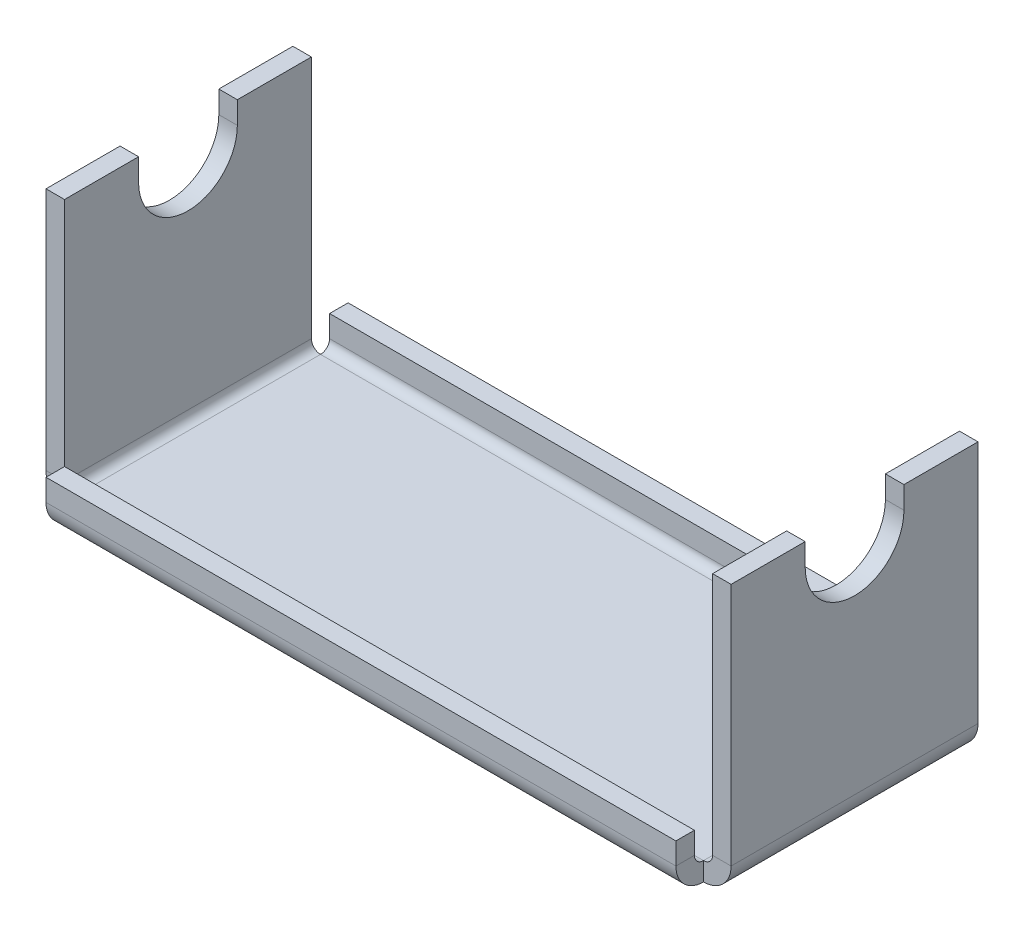
from build123d import *

# Parameters (mm, degrees)
CROQUIS3_W                         = 55.5
CROQUIS3_H                         = 20
BRIDA_BASE1_DEPTH                  = 1.5
BRIDA_DE_ARISTA1_STRIP_W           = 7.4732
BRIDA_DE_ARISTA1_STRIP_H           = 1.5
BRIDA_DE_ARISTA1_STRIP_CUT_DEPTH   = 20
BRIDA_DE_ARISTA1_STRIP_2_W         = 7.4732
BRIDA_DE_ARISTA1_STRIP_2_H         = 1.5
BRIDA_DE_ARISTA1_STRIP_CUT_2_DEPTH = 20
BRIDA_DE_ARISTA1_DEPTH             = 20
BRIDA_DE_ARISTA1_BEND_DEPTH        = 20
BRIDA_DE_ARISTA2_DEPTH             = 51.0268
BRIDA_DE_ARISTA2_BEND_DEPTH        = 51.0268
CORTAR_EXTRUIR1_REACH              = 62.417


# Sheet-metal steps are written as plain solids
with BuildPart() as part:
    # Croquis3 → Brida base1 (new body)
    with BuildSketch(Plane(origin=(0, 0, 0), x_dir=(1, 0, 0), z_dir=(0, 1, 0))):
        Rectangle(CROQUIS3_W, CROQUIS3_H)
    extrude(amount=-BRIDA_BASE1_DEPTH)

    # Brida de arista1 strip (across the edge) → Brida de arista1 strip cut (cut)
    with BuildSketch(Plane(origin=(-27.75, 0, -10), x_dir=(1, 0, 0), z_dir=(0, 0, 1))):
        with Locations((-1.5, -0.75)):
            Rectangle(BRIDA_DE_ARISTA1_STRIP_W, BRIDA_DE_ARISTA1_STRIP_H)
    extrude(amount=BRIDA_DE_ARISTA1_STRIP_CUT_DEPTH, mode=Mode.SUBTRACT)

    # Brida de arista1 strip 2 (across the edge) → Brida de arista1 strip cut 2 (cut)
    with BuildSketch(Plane(origin=(27.75, 0, 10), x_dir=(-1, 0, 0), z_dir=(0, 0, -1))):
        with Locations((-1.5, -0.75)):
            Rectangle(BRIDA_DE_ARISTA1_STRIP_2_W, BRIDA_DE_ARISTA1_STRIP_2_H)
    extrude(amount=BRIDA_DE_ARISTA1_STRIP_CUT_2_DEPTH, mode=Mode.SUBTRACT)

    # Brida de arista1 section (across the edge) → Brida de arista1 (add)
    with BuildSketch(Plane(origin=(-27.75, 0, -10), x_dir=(1, 0, 0), z_dir=(0, 0, 1))):
        with BuildLine():
            Line((0, 0.7366), (0, 20.5))
            Line((0, 20.5), (1.5, 20.5))
            Line((1.5, 20.5), (1.5, 0.7366))
            ThreePointArc((1.5, 0.7366), (1.715745145, 0.215745145), (2.2366, 0))
            Line((2.2366, 0), (2.2366, -1.5))
            ThreePointArc((2.2366, -1.5), (0.655084973, -0.844915027), (0, 0.7366))
        make_face()
    extrude(amount=BRIDA_DE_ARISTA1_DEPTH)

    # Brida de arista1 section 2 (across the edge) → Brida de arista1 bend (add)
    with BuildSketch(Plane(origin=(27.75, 0, 10), x_dir=(-1, 0, 0), z_dir=(0, 0, -1))):
        with BuildLine():
            Line((0, 0.7366), (0, 20.5))
            Line((0, 20.5), (1.5, 20.5))
            Line((1.5, 20.5), (1.5, 0.7366))
            ThreePointArc((1.5, 0.7366), (1.715745145, 0.215745145), (2.2366, 0))
            Line((2.2366, 0), (2.2366, -1.5))
            ThreePointArc((2.2366, -1.5), (0.655084973, -0.844915027), (0, 0.7366))
        make_face()
    extrude(amount=BRIDA_DE_ARISTA1_BEND_DEPTH)

    # Brida de arista2 section (across the edge) → Brida de arista2 (add)
    with BuildSketch(Plane(origin=(-25.5134, 0, 10.7366), x_dir=(0, 0, -1), z_dir=(1, 0, 0))):
        with BuildLine():
            Line((-1.5, 0.7366), (-1.5, 2.5))
            Line((-1.5, 2.5), (0, 2.5))
            Line((0, 2.5), (0, 0.7366))
            ThreePointArc((0, 0.7366), (0.215745145, 0.215745145), (0.7366, 0))
            Line((0.7366, 0), (0.7366, -1.5))
            ThreePointArc((0.7366, -1.5), (-0.844915027, -0.844915027), (-1.5, 0.7366))
        make_face()
    extrude(amount=BRIDA_DE_ARISTA2_DEPTH)

    # Brida de arista2 section 2 (across the edge) → Brida de arista2 bend (add)
    with BuildSketch(Plane(origin=(25.5134, 0, -10.7366), x_dir=(0, 0, 1), z_dir=(-1, 0, 0))):
        with BuildLine():
            Line((-1.5, 0.7366), (-1.5, 2.5))
            Line((-1.5, 2.5), (0, 2.5))
            Line((0, 2.5), (0, 0.7366))
            ThreePointArc((0, 0.7366), (0.215745145, 0.215745145), (0.7366, 0))
            Line((0.7366, 0), (0.7366, -1.5))
            ThreePointArc((0.7366, -1.5), (-0.844915027, -0.844915027), (-1.5, 0.7366))
        make_face()
    extrude(amount=BRIDA_DE_ARISTA2_BEND_DEPTH)

    # Cortar-Extruir1: up to this face of the body (flat: up to its plane)
    cortar_extruir1_end = Plane(part.part.faces().sort_by_distance((-27.75, 10.6183, 0))[0])
    # Croquis20 → Cortar-Extruir1 (cut, up to the picked face)
    with BuildSketch(Plane(origin=(27.75, 0, 0), x_dir=(0, 0, -1), z_dir=(1, 0, 0)), mode=Mode.PRIVATE) as cortar_extruir1_sk1:
        with BuildLine():
            Line((4, 18.7), (4, 22.7))
            Line((4, 22.7), (-4, 22.7))
            Line((-4, 22.7), (-4, 18.7))
            ThreePointArc((-4, 18.7), (0, 14.7), (4, 18.7))
        make_face()
    cortar_extruir1_tool1 = split(extrude(cortar_extruir1_sk1.sketch, amount=-CORTAR_EXTRUIR1_REACH, mode=Mode.PRIVATE), bisect_by=cortar_extruir1_end, keep=Keep.BOTH, mode=Mode.PRIVATE)
    add(cortar_extruir1_tool1.solids().sort_by(Axis((27.75, 19.073399, 0), (-1, 0, 0)))[0], mode=Mode.SUBTRACT)


solid = part.part
